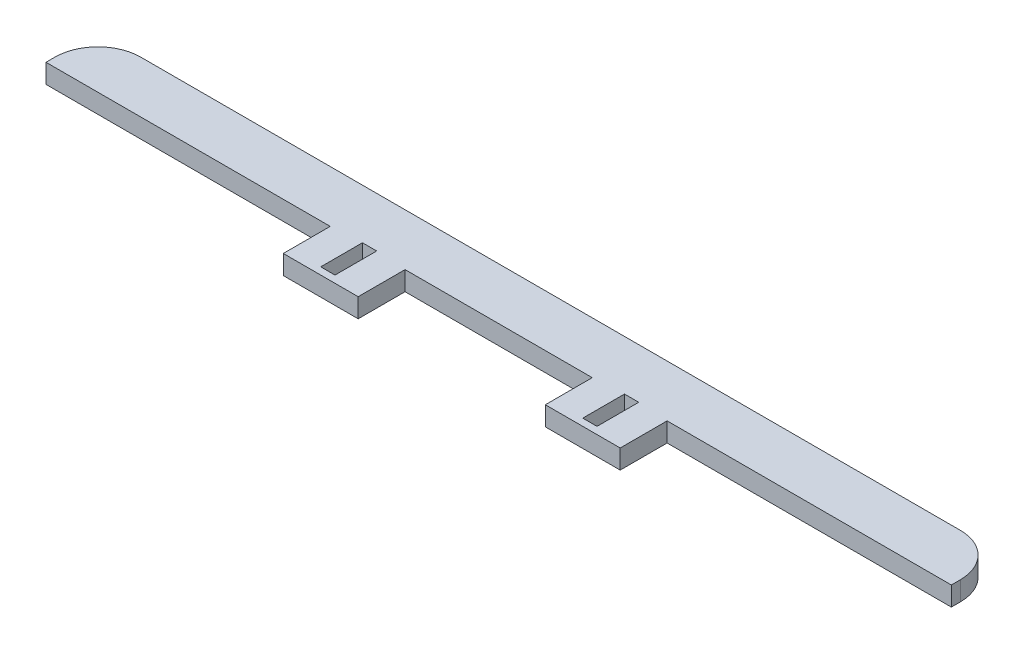
from build123d import *

# Parameters (mm, degrees)
SKETCH1_W             = 62
SKETCH1_H             = 12.7
BOSS_EXTRUDE1_DEPTH   = 5.38
SKETCH2_W             = 20.5
SKETCH2_H             = 5.38
CUT_EXTRUDE1_DEPTH    = 10.16
SKETCH3_W             = 4
SKETCH3_H             = 8.7
CUT_EXTRUDE2_DEPTH    = 5.38
SKETCH4_W             = 2.54
SKETCH4_H             = 5.38
BOSS_EXTRUDE2_DEPTH   = 59.22
SKETCH5_W             = 2.54
SKETCH5_H             = 5.38
BOSS_EXTRUDE3_DEPTH   = 11.5
BODY_MOVE_COPY3_ANGLE = 180
SKETCH6_W             = 21
SKETCH6_H             = 5.38
BOSS_EXTRUDE4_DEPTH   = 3
SKETCH7_W             = 21
SKETCH7_H             = 5.38
BOSS_EXTRUDE5_DEPTH   = 3
SKETCH8_W             = 4
SKETCH8_H             = 5.38
CUT_EXTRUDE3_DEPTH    = 3
SKETCH9_W             = 4
SKETCH9_H             = 5.38
CUT_EXTRUDE4_DEPTH    = 3
SKETCH11_W            = 253.94
SKETCH11_H            = 5.38
BOSS_EXTRUDE6_DEPTH   = 12
FILLET1_R             = 12


with BuildPart() as part:
    # Sketch1 → Boss-Extrude1 (new body)
    with BuildSketch(Plane(origin=(0, 0, 0), x_dir=(1, 0, 0), z_dir=(0, 1, 0))):
        with Locations((-31, 6.35)):
            Rectangle(SKETCH1_W, SKETCH1_H)
    extrude(amount=BOSS_EXTRUDE1_DEPTH)

    # Sketch2 → Cut-Extrude1 (cut)
    with BuildSketch(Plane.XY):
        with Locations((-51.75, 2.69)):
            Rectangle(SKETCH2_W, SKETCH2_H)
        with Locations((-10.25, 2.69)):
            Rectangle(SKETCH2_W, SKETCH2_H)
    extrude(amount=-CUT_EXTRUDE1_DEPTH, mode=Mode.SUBTRACT)

    # Sketch3 → Cut-Extrude2 (cut)
    with BuildSketch(Plane(origin=(0, 5.38, 0), x_dir=(1, 0, 0), z_dir=(0, 1, 0))):
        with Locations((-31, 6.35)):
            Rectangle(SKETCH3_W, SKETCH3_H)
    extrude(amount=-CUT_EXTRUDE2_DEPTH, mode=Mode.SUBTRACT)

    # Sketch4 → Boss-Extrude2 (add)
    with BuildSketch(Plane.ZY.offset(62)):
        with Locations((-11.43, 2.69)):
            Rectangle(SKETCH4_W, SKETCH4_H)
    extrude(amount=BOSS_EXTRUDE2_DEPTH)


with BuildPart() as body_2:
    # Body-Move/Copy1: copy of part
    add(part.part.moved(Location((0, 31.265873305, 0))))


with BuildPart() as part_1:
    add(part.part)

    # Sketch5 → Boss-Extrude3 (add)
    with BuildSketch(Plane(origin=(0, 0, 0), x_dir=(0, 0, -1), z_dir=(1, 0, 0))):
        with Locations((11.43, 2.69)):
            Rectangle(SKETCH5_W, SKETCH5_H)
    extrude(amount=BOSS_EXTRUDE3_DEPTH)


with BuildPart() as body_2_1:
    # Body-Move/Copy2: moved
    add(body_2.part.moved(Location((152.693560216, 0, 0))))


with BuildPart() as body_2_2:
    # Body-Move/Copy3: moved
    add(body_2_1.part.rotate(Axis((92.083560216, 33.955873305, 0), (0, 0, 1)), BODY_MOVE_COPY3_ANGLE))


with BuildPart() as body_2_3:
    # Body-Move/Copy4: read off the stored shape, not the designer's step
    # Body-Move/Copy4: moved
    add(body_2_2.part.moved(Location((-19.9735602, -31.2658733, 0))))

    # Combine1: union part
    add(part_1.part)

    # Sketch6 → Boss-Extrude4 (add)
    with BuildSketch(Plane.XY):
        with Locations((-31, 2.69)):
            Rectangle(SKETCH6_W, SKETCH6_H)
    extrude(amount=BOSS_EXTRUDE4_DEPTH)

    # Sketch7 → Boss-Extrude5 (add)
    with BuildSketch(Plane.XY):
        with Locations((42.5, 2.69)):
            Rectangle(SKETCH7_W, SKETCH7_H)
    extrude(amount=BOSS_EXTRUDE5_DEPTH)

    # Sketch8 → Cut-Extrude3 (cut)
    with BuildSketch(Plane(origin=(0, 0, -2), x_dir=(-1, 0, 0), z_dir=(0, 0, -1))):
        with Locations((31, 2.69)):
            Rectangle(SKETCH8_W, SKETCH8_H)
    extrude(amount=-CUT_EXTRUDE3_DEPTH, mode=Mode.SUBTRACT)

    # Sketch9 → Cut-Extrude4 (cut)
    with BuildSketch(Plane(origin=(0, 0, -2), x_dir=(-1, 0, 0), z_dir=(0, 0, -1))):
        with Locations((-42.5, 2.69)):
            Rectangle(SKETCH9_W, SKETCH9_H)
    extrude(amount=-CUT_EXTRUDE4_DEPTH, mode=Mode.SUBTRACT)

    # Sketch11 → Boss-Extrude6 (add)
    with BuildSketch(Plane(origin=(0, 0, -12.7), x_dir=(-1, 0, 0), z_dir=(0, 0, -1))):
        with Locations((-5.75, 2.69)):
            Rectangle(SKETCH11_W, SKETCH11_H)
    extrude(amount=BOSS_EXTRUDE6_DEPTH)

    # Fillet1
    fillet1_edges = [body_2_3.edges().sort_by_distance(p)[0] for p in [
        (132.72, 2.69, -24.7),
        (-121.22, 2.69, -24.7),
    ]]
    fillet(fillet1_edges, radius=FILLET1_R)


solid = body_2_3.part
